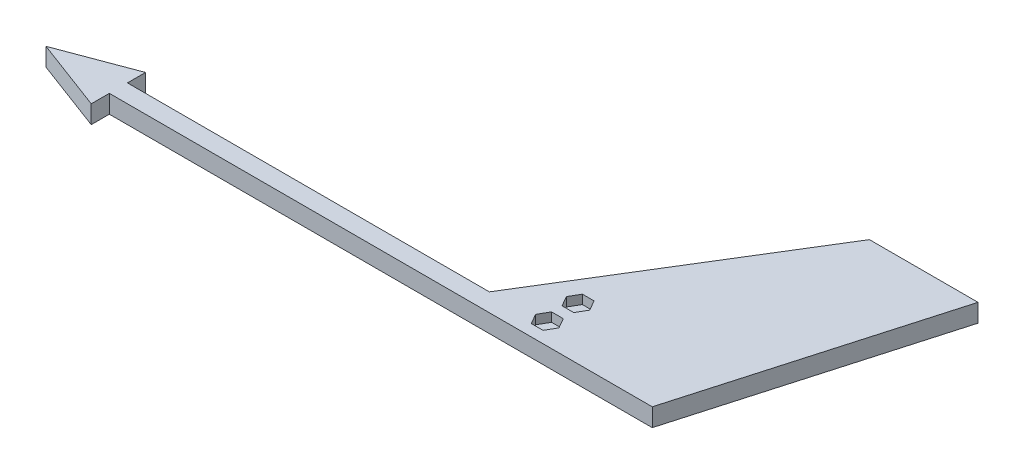
from build123d import *

# Parameters (mm, degrees)
BOSS_EXTRUDE1_DEPTH = 2.5
CUT_EXTRUDE2_DEPTH  = 2.5


with BuildPart() as part:
    # Sketch1 → Boss-Extrude1 (new, symmetric)
    with BuildSketch(Plane(origin=(0, 0, 0), x_dir=(1, 0, 0), z_dir=(0, 1, 0))):
        Polygon((-20, 0), (0, 7.5), (0, 2.5), (100, 2.5), (140, 67.5), (170, 67.5), (150, -2.5), (0, -2.5), (0, -7.5), align=None)
    extrude(amount=BOSS_EXTRUDE1_DEPTH, both=True)

    # Sketch2 → Cut-Extrude2 (cut)
    with BuildSketch(Plane(origin=(0, 2.5, 0), x_dir=(1, 0, 0), z_dir=(0, 1, 0))):
        Polygon((118.233161507, 12), (116.616580754, 14.8), (113.383419246, 14.8), (111.766838493, 12), (113.383419246, 9.2), (116.616580754, 9.2), align=None)
        Polygon((118.233161507, 3.5), (116.616580754, 6.3), (113.383419246, 6.3), (111.766838493, 3.5), (113.383419246, 0.7), (116.616580754, 0.7), align=None)
    extrude(amount=-CUT_EXTRUDE2_DEPTH, mode=Mode.SUBTRACT)


solid = part.part
